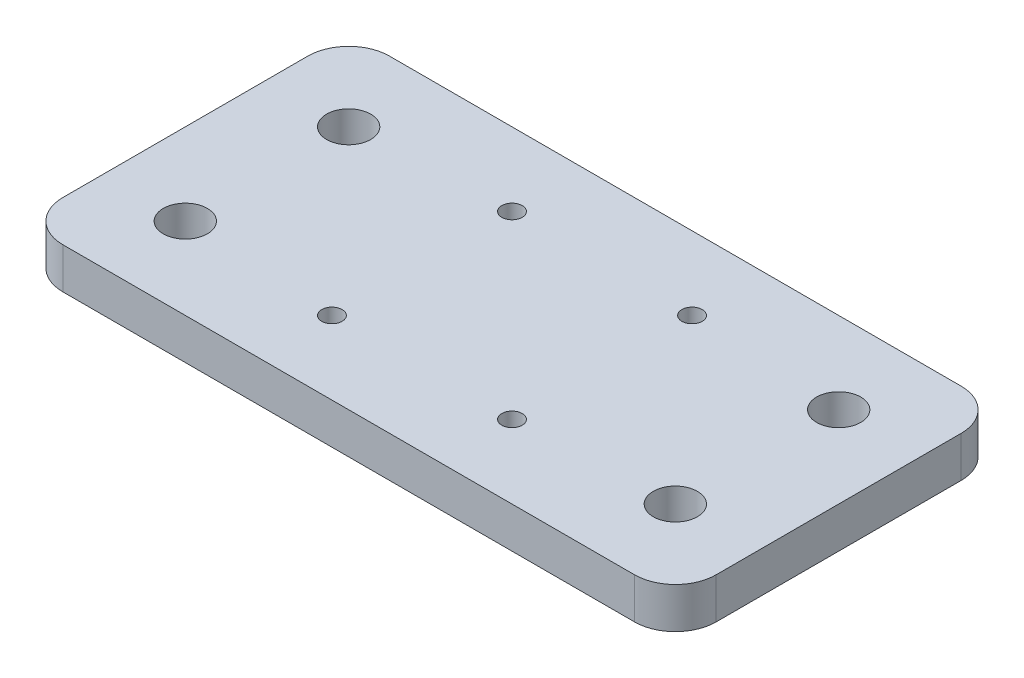
from build123d import *

# Parameters (mm, degrees)
SKETCH1_W           = 101.6
SKETCH1_H           = 50.8
BOSS_EXTRUDE1_DEPTH = 6.35
CUT_EXTRUDE2_REACH  = 59.15
SKETCH3_R           = 3.429
SKETCH3_R_2         = 1.5875
FILLET1_R           = 6.35


with BuildPart() as part:
    # Sketch1 → Boss-Extrude1 (new body)
    with BuildSketch(Plane(origin=(0, 0, 0), x_dir=(1, 0, 0), z_dir=(0, 1, 0))):
        Rectangle(SKETCH1_W, SKETCH1_H)
    extrude(amount=BOSS_EXTRUDE1_DEPTH)

    # Sketch3 → Cut-Extrude2 (cut, up to next)
    with BuildSketch(Plane.XZ, mode=Mode.PRIVATE) as cut_extrude2_sk1:
        with Locations((-38.1, 12.7)):
            Circle(SKETCH3_R)
    cut_extrude2_tool1 = extrude(cut_extrude2_sk1.sketch, amount=-CUT_EXTRUDE2_REACH, mode=Mode.PRIVATE) & part.part
    # Sketch3 → Cut-Extrude2 (cut, up to next)
    with BuildSketch(Plane.XZ, mode=Mode.PRIVATE) as cut_extrude2_sk2:
        with Locations((-38.1, -12.7)):
            Circle(SKETCH3_R)
    cut_extrude2_tool2 = extrude(cut_extrude2_sk2.sketch, amount=-CUT_EXTRUDE2_REACH, mode=Mode.PRIVATE) & part.part
    # Sketch3 → Cut-Extrude2 (cut, up to next)
    with BuildSketch(Plane.XZ, mode=Mode.PRIVATE) as cut_extrude2_sk3:
        with Locations((38.1, 12.7)):
            Circle(SKETCH3_R)
    cut_extrude2_tool3 = extrude(cut_extrude2_sk3.sketch, amount=-CUT_EXTRUDE2_REACH, mode=Mode.PRIVATE) & part.part
    # Sketch3 → Cut-Extrude2 (cut, up to next)
    with BuildSketch(Plane.XZ, mode=Mode.PRIVATE) as cut_extrude2_sk4:
        with Locations((38.1, -12.7)):
            Circle(SKETCH3_R)
    cut_extrude2_tool4 = extrude(cut_extrude2_sk4.sketch, amount=-CUT_EXTRUDE2_REACH, mode=Mode.PRIVATE) & part.part
    # Sketch3 → Cut-Extrude2 (cut, up to next)
    with BuildSketch(Plane.XZ, mode=Mode.PRIVATE) as cut_extrude2_sk5:
        with Locations((14, -14)):
            Circle(SKETCH3_R_2)
    cut_extrude2_tool5 = extrude(cut_extrude2_sk5.sketch, amount=-CUT_EXTRUDE2_REACH, mode=Mode.PRIVATE) & part.part
    # Sketch3 → Cut-Extrude2 (cut, up to next)
    with BuildSketch(Plane.XZ, mode=Mode.PRIVATE) as cut_extrude2_sk6:
        with Locations((-14, -14)):
            Circle(SKETCH3_R_2)
    cut_extrude2_tool6 = extrude(cut_extrude2_sk6.sketch, amount=-CUT_EXTRUDE2_REACH, mode=Mode.PRIVATE) & part.part
    # Sketch3 → Cut-Extrude2 (cut, up to next)
    with BuildSketch(Plane.XZ, mode=Mode.PRIVATE) as cut_extrude2_sk7:
        with Locations((14, 14)):
            Circle(SKETCH3_R_2)
    cut_extrude2_tool7 = extrude(cut_extrude2_sk7.sketch, amount=-CUT_EXTRUDE2_REACH, mode=Mode.PRIVATE) & part.part
    # Sketch3 → Cut-Extrude2 (cut, up to next)
    with BuildSketch(Plane.XZ, mode=Mode.PRIVATE) as cut_extrude2_sk8:
        with Locations((-14, 14)):
            Circle(SKETCH3_R_2)
    cut_extrude2_tool8 = extrude(cut_extrude2_sk8.sketch, amount=-CUT_EXTRUDE2_REACH, mode=Mode.PRIVATE) & part.part
    add(cut_extrude2_tool1.solids().sort_by_distance((-38.1, 0, 12.7))[0], mode=Mode.SUBTRACT)
    add(cut_extrude2_tool2.solids().sort_by_distance((-38.1, 0, -12.7))[0], mode=Mode.SUBTRACT)
    add(cut_extrude2_tool3.solids().sort_by_distance((38.1, 0, 12.7))[0], mode=Mode.SUBTRACT)
    add(cut_extrude2_tool4.solids().sort_by_distance((38.1, 0, -12.7))[0], mode=Mode.SUBTRACT)
    add(cut_extrude2_tool5.solids().sort_by_distance((14, 0, -14))[0], mode=Mode.SUBTRACT)
    add(cut_extrude2_tool6.solids().sort_by_distance((-14, 0, -14))[0], mode=Mode.SUBTRACT)
    add(cut_extrude2_tool7.solids().sort_by_distance((14, 0, 14))[0], mode=Mode.SUBTRACT)
    add(cut_extrude2_tool8.solids().sort_by_distance((-14, 0, 14))[0], mode=Mode.SUBTRACT)

    # Fillet1
    fillet1_edges = [part.edges().sort_by_distance(p)[0] for p in [
        (-50.8, 3.175, -25.4),
        (50.8, 3.175, -25.4),
        (50.8, 3.175, 25.4),
        (-50.8, 3.175, 25.4),
    ]]
    fillet(fillet1_edges, radius=FILLET1_R)


solid = part.part
